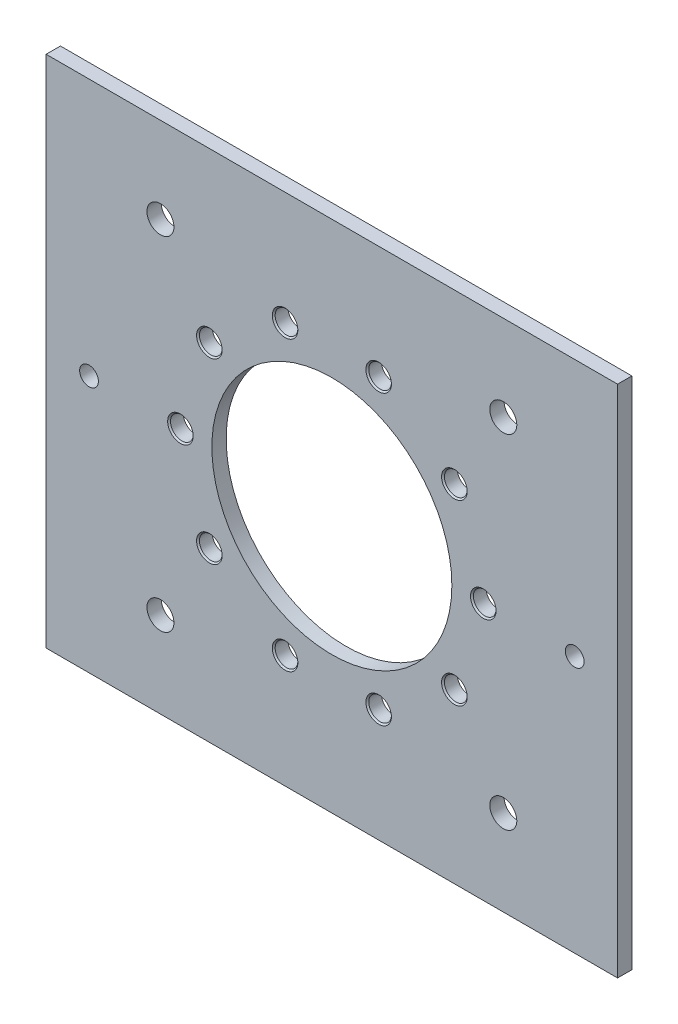
from build123d import *

# Parameters (mm, degrees)
SKETCH1_W                         = 254
SKETCH1_H                         = 228.6
SKETCH1_R                         = 53.34
BOSS_EXTRUDE1_DEPTH               = 6.35
F_3_8_CLEARANCE_HOLE1_D           = 10.0838
F_3_8_CLEARANCE_HOLE1_CSINK_D     = 11.3538
F_3_8_CLEARANCE_HOLE1_CSINK_ANGLE = 90
F_12_0_12_DIAMETER_HOLE1_D        = 12
SKETCH11_R                        = 4.1656
CUT_EXTRUDE1_DEPTH                = 171.978982627


with BuildPart() as part:
    # Sketch1 → Boss-Extrude1 (new body)
    with BuildSketch(Plane.XY):
        Rectangle(SKETCH1_W, SKETCH1_H)
        Circle(SKETCH1_R, mode=Mode.SUBTRACT)
    extrude(amount=BOSS_EXTRUDE1_DEPTH)

    # 3/8 Clearance Hole1 (through all)
    with Locations(Plane.XY.offset(6.35)):
        with Locations((-54.454933891, -39.563825332), (-67.31, 0), (-54.454933891, 39.563825332), (-20.799933891, 64.015614112), (20.799933891, 64.015614112), (54.454933891, 39.563825332), (67.31, 0), (54.454933891, -39.563825332), (20.799933891, -64.015614112), (-20.799933891, -64.015614112)):
            CounterSinkHole(F_3_8_CLEARANCE_HOLE1_D / 2, F_3_8_CLEARANCE_HOLE1_CSINK_D / 2, counter_sink_angle=F_3_8_CLEARANCE_HOLE1_CSINK_ANGLE)

    # Ø12.0 (12) Diameter Hole1 (through all)
    with Locations(Plane(origin=(0, 0, 0), x_dir=(-1, 0, 0), z_dir=(0, 0, -1))):
        with Locations((76.2, 76.2), (76.2, -76.2), (-76.2, -76.2), (-76.2, 76.2)):
            Hole(F_12_0_12_DIAMETER_HOLE1_D / 2)

    # Sketch11 → Cut-Extrude1 (cut, through all)
    with BuildSketch(Plane(origin=(0, 0, 0), x_dir=(-1, 0, 0), z_dir=(0, 0, -1))):
        with Locations((107.95, 0)):
            Circle(SKETCH11_R)
        with Locations((-107.95, 0)):
            Circle(SKETCH11_R)
    extrude(amount=-CUT_EXTRUDE1_DEPTH, mode=Mode.SUBTRACT)


solid = part.part
